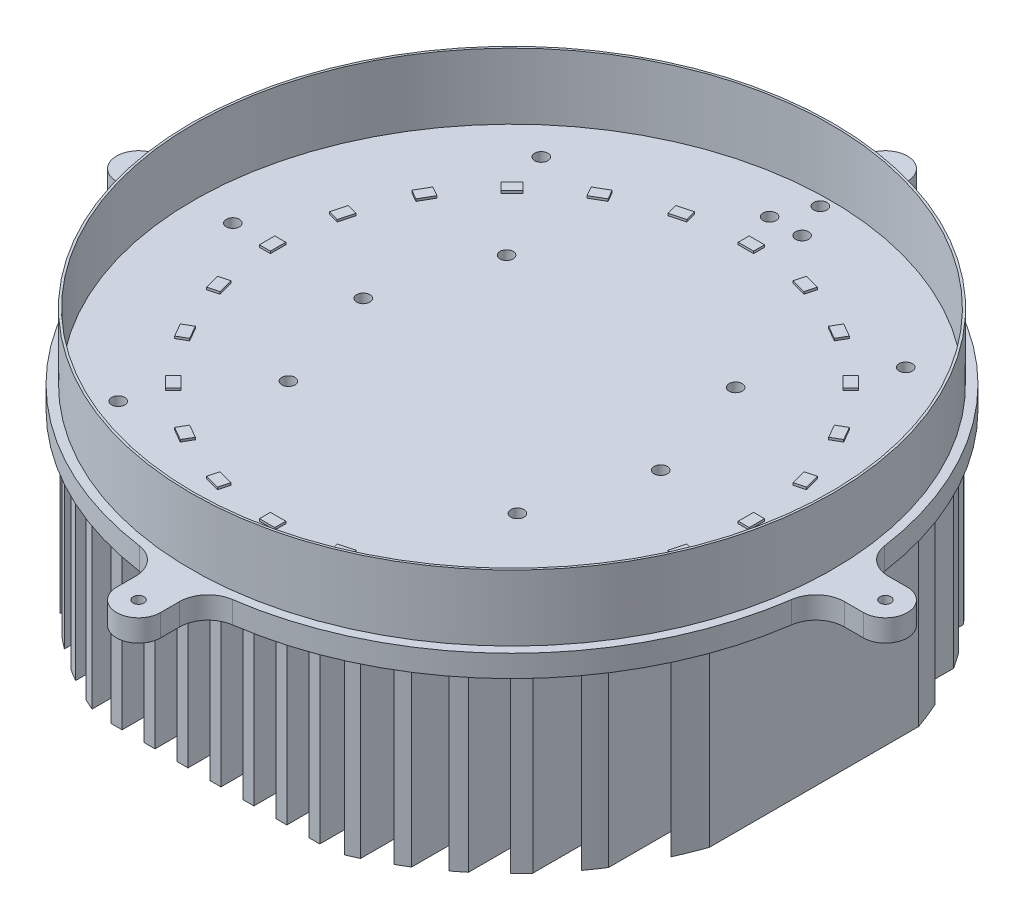
from build123d import *

# Parameters (mm, degrees)
SKETCH2_R           = 146
SKETCH2_R_2         = 145
BOSS_EXTRUDE2_DEPTH = 30
SKETCH3_R           = 2.5
BOSS_EXTRUDE4_DEPTH = 10
SKETCH4_W           = 5
SKETCH4_H           = 270
BOSS_EXTRUDE5_DEPTH = 80
BOSS_EXTRUDE6_DEPTH = 1
SKETCH7_R           = 3
CUT_EXTRUDE1_DEPTH  = 10


with BuildPart() as part:
    # Sketch2 → Boss-Extrude2 (new body)
    with BuildSketch(Plane(origin=(0, 0, 0), x_dir=(1, 0, 0), z_dir=(0, 1, 0))):
        Circle(SKETCH2_R)
        Circle(SKETCH2_R_2, mode=Mode.SUBTRACT)
    extrude(amount=BOSS_EXTRUDE2_DEPTH)

    # Sketch3 → Boss-Extrude4 (add)
    with BuildSketch(Plane(origin=(0, 0, 0), x_dir=(1, 0, 0), z_dir=(0, 1, 0))):
        with BuildLine():
            Line((161.369142032, 10), (170, 10))
            ThreePointArc((170, 10), (180, 0), (170, -10))
            Line((170, -10), (161.369142032, -10))
            ThreePointArc((161.369142032, -10), (152.849946816, -13.180462695), (148.499210458, -21.165644172))
            ThreePointArc((148.499210458, -21.165644172), (106.066017178, -106.066017178), (21.165644172, -148.499210458))
            ThreePointArc((21.165644172, -148.499210458), (13.180462695, -152.849946816), (10, -161.369142032))
            Line((10, -161.369142032), (10, -170))
            ThreePointArc((10, -170), (0, -180), (-10, -170))
            Line((-10, -170), (-10, -161.369142032))
            ThreePointArc((-10, -161.369142032), (-13.180462695, -152.849946816), (-21.165644172, -148.499210458))
            ThreePointArc((-21.165644172, -148.499210458), (-106.066017178, -106.066017178), (-148.499210458, -21.165644172))
            ThreePointArc((-148.499210458, -21.165644172), (-152.849946816, -13.180462695), (-161.369142032, -10))
            Line((-161.369142032, -10), (-170, -10))
            ThreePointArc((-170, -10), (-180, 0), (-170, 10))
            Line((-170, 10), (-161.369142032, 10))
            ThreePointArc((-161.369142032, 10), (-152.849946816, 13.180462695), (-148.499210458, 21.165644172))
            ThreePointArc((-148.499210458, 21.165644172), (-106.066017178, 106.066017178), (-21.165644172, 148.499210458))
            ThreePointArc((-21.165644172, 148.499210458), (-13.180462695, 152.849946816), (-10, 161.369142032))
            Line((-10, 161.369142032), (-10, 170))
            ThreePointArc((-10, 170), (0, 180), (10, 170))
            Line((10, 170), (10, 161.369142032))
            ThreePointArc((10, 161.369142032), (13.180462695, 152.849946816), (21.165644172, 148.499210458))
            ThreePointArc((21.165644172, 148.499210458), (106.066017178, 106.066017178), (148.499210458, 21.165644172))
            ThreePointArc((148.499210458, 21.165644172), (152.849946816, 13.180462695), (161.369142032, 10))
        make_face()
        with Locations((0, 170)):
            Circle(SKETCH3_R, mode=Mode.SUBTRACT)
        with Locations((170, 0)):
            Circle(SKETCH3_R, mode=Mode.SUBTRACT)
        with Locations((0, -170)):
            Circle(SKETCH3_R, mode=Mode.SUBTRACT)
        with Locations((-170, 0)):
            Circle(SKETCH3_R, mode=Mode.SUBTRACT)
    extrude(amount=-BOSS_EXTRUDE4_DEPTH)

    # Sketch4 → Boss-Extrude5 (add)
    with BuildSketch(Plane.XZ.offset(10)):
        Rectangle(SKETCH4_W, SKETCH4_H)
        with Locations((15, 0)):
            Rectangle(SKETCH4_W, SKETCH4_H)
        with Locations((30, 0)):
            Rectangle(SKETCH4_W, SKETCH4_H)
        with Locations((45, 0)):
            Rectangle(SKETCH4_W, SKETCH4_H)
        with BuildLine():
            Line((57.5, -133.656275573), (57.5, 133.656275573))
            ThreePointArc((57.5, 133.656275573), (60.010675074, 132.547987073), (62.5, 131.392541645))
            Line((62.5, 131.392541645), (62.5, -131.392541645))
            ThreePointArc((62.5, -131.392541645), (60.010675074, -132.547987073), (57.5, -133.656275573))
        make_face()
        with BuildLine():
            Line((72.5, -126.150703526), (72.5, 126.150703526))
            ThreePointArc((72.5, 126.150703526), (75.015083697, 124.671517268), (77.5, 123.142194231))
            Line((77.5, 123.142194231), (77.5, -123.142194231))
            ThreePointArc((77.5, -123.142194231), (75.015083697, -124.671517268), (72.5, -126.150703526))
        make_face()
        with BuildLine():
            Line((87.5, -116.249731182), (87.5, 116.249731182))
            ThreePointArc((87.5, 116.249731182), (90.021532442, 114.308239846), (92.5, 112.312065247))
            Line((92.5, 112.312065247), (92.5, -112.312065247))
            ThreePointArc((92.5, -112.312065247), (90.021532442, -114.308239846), (87.5, -116.249731182))
        make_face()
        with BuildLine():
            Line((102.5, -103.266645147), (102.5, 103.266645147))
            ThreePointArc((102.5, 103.266645147), (105.032379388, 100.689866819), (107.5, 98.051007134))
            Line((107.5, 98.051007134), (107.5, -98.051007134))
            ThreePointArc((107.5, -98.051007134), (105.032379388, -100.689866819), (102.5, -103.266645147))
        make_face()
        with BuildLine():
            Line((117.5, -85.813751812), (117.5, 85.813751812))
            ThreePointArc((117.5, 85.813751812), (120.055537207, 82.200474366), (122.5, 78.511145706))
            Line((122.5, 78.511145706), (122.5, -78.511145706))
            ThreePointArc((122.5, -78.511145706), (120.055537207, -82.200474366), (117.5, -85.813751812))
        make_face()
        with BuildLine():
            Line((132.5, -60.116553461), (132.5, 60.116553461))
            ThreePointArc((132.5, 60.116553461), (135.145409966, 53.907032613), (137.5, 47.581509013))
            Line((137.5, 47.581509013), (137.5, -47.581509013))
            ThreePointArc((137.5, -47.581509013), (135.145409966, -53.907032613), (132.5, -60.116553461))
        make_face()
        with Locations((-15, 0)):
            Rectangle(SKETCH4_W, SKETCH4_H)
        with Locations((-30, 0)):
            Rectangle(SKETCH4_W, SKETCH4_H)
        with Locations((-45, 0)):
            Rectangle(SKETCH4_W, SKETCH4_H)
        with BuildLine():
            Line((-57.5, -133.656275573), (-57.5, 133.656275573))
            ThreePointArc((-57.5, 133.656275573), (-60.010675074, 132.547987073), (-62.5, 131.392541645))
            Line((-62.5, 131.392541645), (-62.5, -131.392541645))
            ThreePointArc((-62.5, -131.392541645), (-60.010675074, -132.547987073), (-57.5, -133.656275573))
        make_face()
        with BuildLine():
            Line((-72.5, -126.150703526), (-72.5, 126.150703526))
            ThreePointArc((-72.5, 126.150703526), (-75.015083697, 124.671517268), (-77.5, 123.142194231))
            Line((-77.5, 123.142194231), (-77.5, -123.142194231))
            ThreePointArc((-77.5, -123.142194231), (-75.015083697, -124.671517268), (-72.5, -126.150703526))
        make_face()
        with BuildLine():
            Line((-87.5, -116.249731182), (-87.5, 116.249731182))
            ThreePointArc((-87.5, 116.249731182), (-90.021532442, 114.308239846), (-92.5, 112.312065247))
            Line((-92.5, 112.312065247), (-92.5, -112.312065247))
            ThreePointArc((-92.5, -112.312065247), (-90.021532442, -114.308239846), (-87.5, -116.249731182))
        make_face()
        with BuildLine():
            Line((-102.5, -103.266645147), (-102.5, 103.266645147))
            ThreePointArc((-102.5, 103.266645147), (-105.032379388, 100.689866819), (-107.5, 98.051007134))
            Line((-107.5, 98.051007134), (-107.5, -98.051007134))
            ThreePointArc((-107.5, -98.051007134), (-105.032379388, -100.689866819), (-102.5, -103.266645147))
        make_face()
        with BuildLine():
            Line((-117.5, -85.813751812), (-117.5, 85.813751812))
            ThreePointArc((-117.5, 85.813751812), (-120.055537207, 82.200474366), (-122.5, 78.511145706))
            Line((-122.5, 78.511145706), (-122.5, -78.511145706))
            ThreePointArc((-122.5, -78.511145706), (-120.055537207, -82.200474366), (-117.5, -85.813751812))
        make_face()
        with BuildLine():
            Line((-132.5, -60.116553461), (-132.5, 60.116553461))
            ThreePointArc((-132.5, 60.116553461), (-135.145409966, 53.907032613), (-137.5, 47.581509013))
            Line((-137.5, 47.581509013), (-137.5, -47.581509013))
            ThreePointArc((-137.5, -47.581509013), (-135.145409966, -53.907032613), (-132.5, -60.116553461))
        make_face()
    extrude(amount=BOSS_EXTRUDE5_DEPTH)

    # Sketch5 → Boss-Extrude6 (add)
    with BuildSketch(Plane(origin=(0, 0, 0), x_dir=(1, 0, 0), z_dir=(0, 1, 0))):
        Polygon((0, 111.478572259), (3.5, 111.478572259), (3.5, 106.478572259), (0, 106.478572259), (-3.5, 106.478572259), (-3.5, 111.478572259), align=None)
        Polygon((24.177942004, 103.756269549), (25.472037229, 108.585898681), (28.852777621, 107.680032023), (32.233518013, 106.774165365), (30.939422788, 101.944536234), (27.558682396, 102.850402891), align=None)
        Polygon((50.208197216, 93.963148535), (52.708197216, 98.293275554), (55.73928613, 96.543275554), (58.770375043, 94.793275554), (56.270375043, 90.463148535), (53.23928613, 92.213148535), align=None)
        Polygon((72.816846761, 77.76659423), (76.352380667, 81.302128135), (78.827254401, 78.827254401), (81.302128135, 76.352380667), (77.76659423, 72.816846761), (75.291720495, 75.291720495), align=None)
        Polygon((90.463148535, 56.270375043), (94.793275554, 58.770375043), (96.543275554, 55.73928613), (98.293275554, 52.708197216), (93.963148535, 50.208197216), (92.213148535, 53.23928613), align=None)
        Polygon((101.944536234, 30.939422788), (106.774165365, 32.233518013), (107.680032023, 28.852777621), (108.585898681, 25.472037229), (103.756269549, 24.177942004), (102.850402891, 27.558682396), align=None)
        Polygon((106.478572259, 3.5), (111.478572259, 3.5), (111.478572259, 0), (111.478572259, -3.5), (106.478572259, -3.5), (106.478572259, 0), align=None)
        Polygon((103.756269549, -24.177942004), (108.585898681, -25.472037229), (107.680032023, -28.852777621), (106.774165365, -32.233518013), (101.944536234, -30.939422788), (102.850402891, -27.558682396), align=None)
        Polygon((93.963148535, -50.208197216), (98.293275554, -52.708197216), (96.543275554, -55.73928613), (94.793275554, -58.770375043), (90.463148535, -56.270375043), (92.213148535, -53.23928613), align=None)
        Polygon((77.76659423, -72.816846761), (81.302128135, -76.352380667), (78.827254401, -78.827254401), (76.352380667, -81.302128135), (72.816846761, -77.76659423), (75.291720495, -75.291720495), align=None)
        Polygon((56.270375043, -90.463148535), (58.770375043, -94.793275554), (55.73928613, -96.543275554), (52.708197216, -98.293275554), (50.208197216, -93.963148535), (53.23928613, -92.213148535), align=None)
        Polygon((30.939422788, -101.944536234), (32.233518013, -106.774165365), (28.852777621, -107.680032023), (25.472037229, -108.585898681), (24.177942004, -103.756269549), (27.558682396, -102.850402891), align=None)
        Polygon((3.5, -106.478572259), (3.5, -111.478572259), (0, -111.478572259), (-3.5, -111.478572259), (-3.5, -106.478572259), (0, -106.478572259), align=None)
        Polygon((-24.177942004, -103.756269549), (-25.472037229, -108.585898681), (-28.852777621, -107.680032023), (-32.233518013, -106.774165365), (-30.939422788, -101.944536234), (-27.558682396, -102.850402891), align=None)
        Polygon((-50.208197216, -93.963148535), (-52.708197216, -98.293275554), (-55.73928613, -96.543275554), (-58.770375043, -94.793275554), (-56.270375043, -90.463148535), (-53.23928613, -92.213148535), align=None)
        Polygon((-72.816846761, -77.76659423), (-76.352380667, -81.302128135), (-78.827254401, -78.827254401), (-81.302128135, -76.352380667), (-77.76659423, -72.816846761), (-75.291720495, -75.291720495), align=None)
        Polygon((-90.463148535, -56.270375043), (-94.793275554, -58.770375043), (-96.543275554, -55.73928613), (-98.293275554, -52.708197216), (-93.963148535, -50.208197216), (-92.213148535, -53.23928613), align=None)
        Polygon((-101.944536234, -30.939422788), (-106.774165365, -32.233518013), (-107.680032023, -28.852777621), (-108.585898681, -25.472037229), (-103.756269549, -24.177942004), (-102.850402891, -27.558682396), align=None)
        Polygon((-106.478572259, -3.5), (-111.478572259, -3.5), (-111.478572259, 0), (-111.478572259, 3.5), (-106.478572259, 3.5), (-106.478572259, 0), align=None)
        Polygon((-103.756269549, 24.177942004), (-108.585898681, 25.472037229), (-107.680032023, 28.852777621), (-106.774165365, 32.233518013), (-101.944536234, 30.939422788), (-102.850402891, 27.558682396), align=None)
        Polygon((-93.963148535, 50.208197216), (-98.293275554, 52.708197216), (-96.543275554, 55.73928613), (-94.793275554, 58.770375043), (-90.463148535, 56.270375043), (-92.213148535, 53.23928613), align=None)
        Polygon((-77.76659423, 72.816846761), (-81.302128135, 76.352380667), (-78.827254401, 78.827254401), (-76.352380667, 81.302128135), (-72.816846761, 77.76659423), (-75.291720495, 75.291720495), align=None)
        Polygon((-56.270375043, 90.463148535), (-58.770375043, 94.793275554), (-55.73928613, 96.543275554), (-52.708197216, 98.293275554), (-50.208197216, 93.963148535), (-53.23928613, 92.213148535), align=None)
        Polygon((-30.939422788, 101.944536234), (-32.233518013, 106.774165365), (-28.852777621, 107.680032023), (-25.472037229, 108.585898681), (-24.177942004, 103.756269549), (-27.558682396, 102.850402891), align=None)
    extrude(amount=BOSS_EXTRUDE6_DEPTH)

    # Sketch7 → Cut-Extrude1 (cut)
    with BuildSketch(Plane(origin=(0, 0, 0), x_dir=(1, 0, 0), z_dir=(0, 1, 0))):
        with Locations((-127.088241501, 0)):
            Circle(SKETCH7_R)
        with Locations((0, 140.377871213)):
            Circle(SKETCH7_R)
        with Locations((0, -140.377871213)):
            Circle(SKETCH7_R)
        with Locations((127.088241501, 0)):
            Circle(SKETCH7_R)
        with Locations((-67.712428911, 0)):
            Circle(SKETCH7_R)
        with Locations((-52.130916661, 49.662536464)):
            Circle(SKETCH7_R)
        with Locations((52.130916661, 49.662536464)):
            Circle(SKETCH7_R)
        with Locations((52.130916661, -49.662536464)):
            Circle(SKETCH7_R)
        with Locations((-52.130916661, -49.662536464)):
            Circle(SKETCH7_R)
        with Locations((67.712428911, 0)):
            Circle(SKETCH7_R)
        with Locations((-82.954299453, 96.280866896)):
            Circle(SKETCH7_R)
        with Locations((82.954299453, 96.280866896)):
            Circle(SKETCH7_R)
        with Locations((82.954299453, -96.280866896)):
            Circle(SKETCH7_R)
        with Locations((-82.954299453, -96.280866896)):
            Circle(SKETCH7_R)
        with Locations((7.399863504, -124.662387406)):
            Circle(SKETCH7_R)
        with Locations((-7.399863504, -124.662387406)):
            Circle(SKETCH7_R)
        with Locations((7.399863504, 124.662387406)):
            Circle(SKETCH7_R)
        with Locations((-7.399863504, 124.662387406)):
            Circle(SKETCH7_R)
    extrude(amount=-CUT_EXTRUDE1_DEPTH, mode=Mode.SUBTRACT)


solid = part.part
